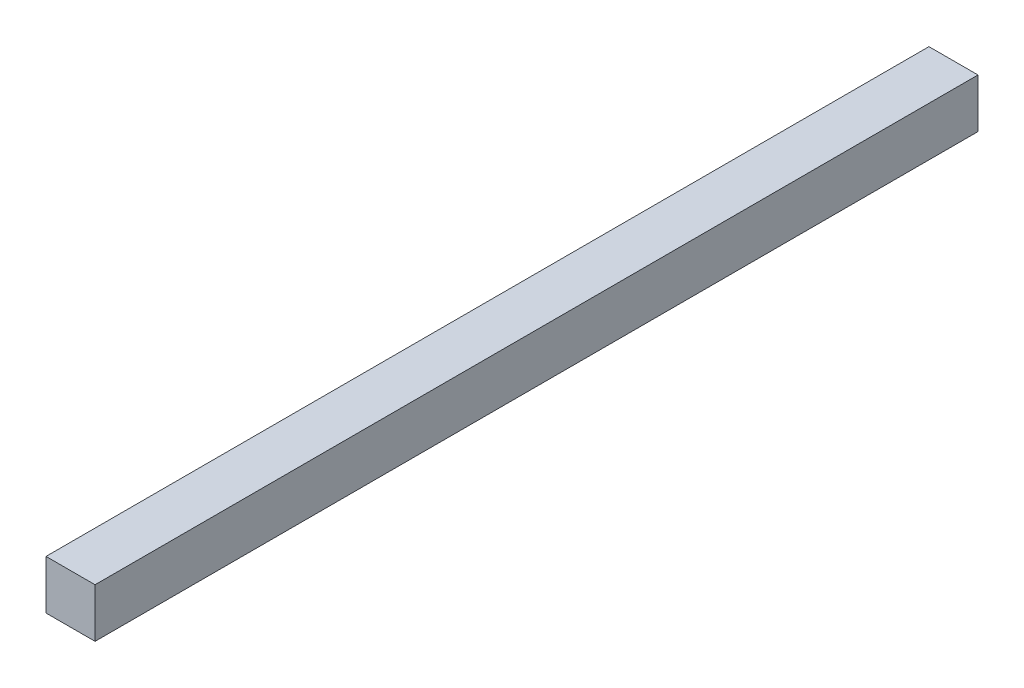
from build123d import *

# Parameters (mm, degrees)
SKETCH1_W           = 40
SKETCH1_H           = 40
BOSS_EXTRUDE1_DEPTH = 720


with BuildPart() as part:
    # Sketch1 → Boss-Extrude1 (new body)
    with BuildSketch(Plane.XY):
        Rectangle(SKETCH1_W, SKETCH1_H)
    extrude(amount=BOSS_EXTRUDE1_DEPTH)


solid = part.part
